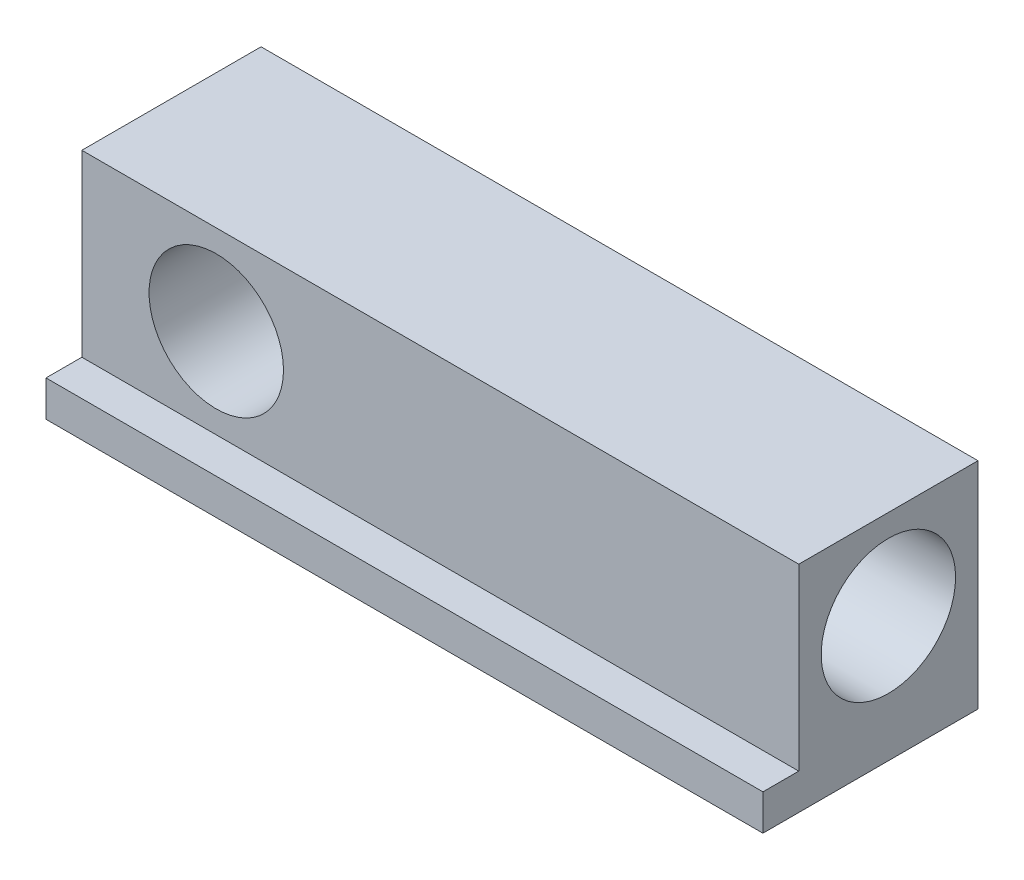
from build123d import *

# Parameters (mm, degrees)
SKETCH1_W               = 20
SKETCH1_H               = 20
BOSS_EXTRUDE1_DEPTH     = 40
CUT_EXTRUDE1_DEPTH      = 43.426406871
CUT_EXTRUDE1_DEPTH_BACK = 43.426406871
SKETCH4_R               = 7.5
SKETCH12_R              = 7.5
CUT_EXTRUDE3_DEPTH      = 40
SKETCH13_W              = 80
SKETCH13_H              = 24
BOSS_EXTRUDE3_DEPTH     = 4


with BuildPart() as part:
    # Sketch1 → Boss-Extrude1 (new, symmetric)
    with BuildSketch(Plane(origin=(0, 0, 0), x_dir=(0, 0, -1), z_dir=(1, 0, 0))):
        Rectangle(SKETCH1_W, SKETCH1_H)
    extrude(amount=BOSS_EXTRUDE1_DEPTH, both=True)

    # Sketch4 → Cut-Extrude1 (cut, two sides: drawn at the far end of the back side and taken through both)
    with BuildSketch(Plane.XY.offset(-CUT_EXTRUDE1_DEPTH_BACK)):
        with Locations((-25, 0)):
            Circle(SKETCH4_R)
    extrude(amount=CUT_EXTRUDE1_DEPTH + CUT_EXTRUDE1_DEPTH_BACK, mode=Mode.SUBTRACT)

    # Sketch12 → Cut-Extrude3 (cut)
    with BuildSketch(Plane(origin=(40, 0, 0), x_dir=(0, 0, -1), z_dir=(1, 0, 0))):
        Circle(SKETCH12_R)
    extrude(amount=-CUT_EXTRUDE3_DEPTH, mode=Mode.SUBTRACT)

    # Sketch13 → Boss-Extrude3 (add)
    with BuildSketch(Plane.XZ.offset(10)):
        with Locations((0, 2)):
            Rectangle(SKETCH13_W, SKETCH13_H)
    extrude(amount=BOSS_EXTRUDE3_DEPTH)


solid = part.part
